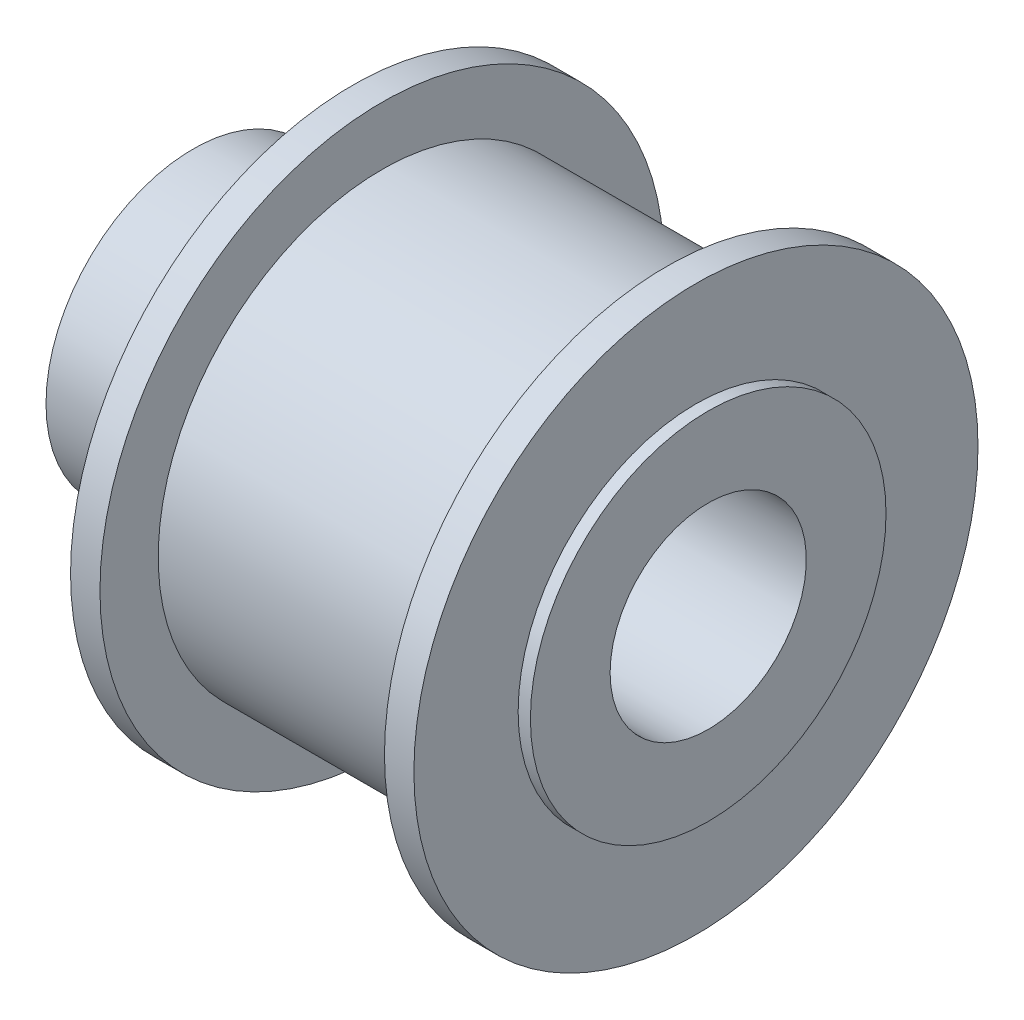
from build123d import *

# Parameters (mm, degrees)
CROQUIS1_R                    = 6
SALIENTE_EXTRUIR1_DEPTH       = 6
CROQUIS2_R                    = 7.25
SALIENTE_EXTRUIR2_DEPTH       = 0.5
CROQUIS3_R                    = 11.5
SALIENTE_EXTRUIR3_DEPTH       = 1.2
CROQUIS4_R                    = 9.125
SALIENTE_EXTRUIR4_DEPTH       = 11.6
CROQUIS5_R                    = 11.5
SALIENTE_EXTRUIR5_DEPTH       = 1.2
CROQUIS6_R                    = 7.25
SALIENTE_EXTRUIR6_DEPTH       = 0.5
CROQUIS7_R                    = 4
CORTAR_EXTRUIR1_DEPTH         = 27.561249971
TALADRO_ROSCADO_M32_D         = 2.5
TALADRO_ROSCADO_M32_DEPTH     = 8.5
TALADRO_ROSCADO_M32_TIP       = 0.751075774
TALADRO_ROSCADO_M33_OUTLINE_W = 1.25
TALADRO_ROSCADO_M33_OUTLINE_H = 5.325356109


# Read off the part's stored shape, not the designer's step: Taladro roscado M33
with BuildPart() as part:
    # Croquis1 → Saliente-Extruir1 (new body)
    with BuildSketch(Plane(origin=(0, 0, 0), x_dir=(0, 0, -1), z_dir=(1, 0, 0))):
        Circle(CROQUIS1_R)
    extrude(amount=SALIENTE_EXTRUIR1_DEPTH)

    # Croquis2 → Saliente-Extruir2 (add)
    with BuildSketch(Plane(origin=(6, 0, 0), x_dir=(0, 0, -1), z_dir=(1, 0, 0))):
        Circle(CROQUIS2_R)
    extrude(amount=SALIENTE_EXTRUIR2_DEPTH)

    # Croquis3 → Saliente-Extruir3 (add)
    with BuildSketch(Plane(origin=(6.5, 0, 0), x_dir=(0, 0, -1), z_dir=(1, 0, 0))):
        Circle(CROQUIS3_R)
    extrude(amount=SALIENTE_EXTRUIR3_DEPTH)

    # Croquis4 → Saliente-Extruir4 (add)
    with BuildSketch(Plane(origin=(7.7, 0, 0), x_dir=(0, 0, -1), z_dir=(1, 0, 0))):
        Circle(CROQUIS4_R)
    extrude(amount=SALIENTE_EXTRUIR4_DEPTH)

    # Croquis5 → Saliente-Extruir5 (add)
    with BuildSketch(Plane(origin=(19.3, 0, 0), x_dir=(0, 0, -1), z_dir=(1, 0, 0))):
        Circle(CROQUIS5_R)
    extrude(amount=SALIENTE_EXTRUIR5_DEPTH)

    # Croquis6 → Saliente-Extruir6 (add)
    with BuildSketch(Plane(origin=(20.5, 0, 0), x_dir=(0, 0, -1), z_dir=(1, 0, 0))):
        Circle(CROQUIS6_R)
    extrude(amount=SALIENTE_EXTRUIR6_DEPTH)

    # Croquis7 → Cortar-Extruir1 (cut, through all)
    with BuildSketch(Plane.ZY):
        Circle(CROQUIS7_R)
    extrude(amount=-CORTAR_EXTRUIR1_DEPTH, mode=Mode.SUBTRACT)

    # Taladro roscado M32
    with Locations(Plane(origin=(0, 0, -6), x_dir=(-1, 0, 0), z_dir=(0, 0, -1))):
        with Locations((-3.5, 0)):
            Hole(TALADRO_ROSCADO_M32_D / 2, depth=TALADRO_ROSCADO_M32_DEPTH)
            with Locations((0, 0, -(TALADRO_ROSCADO_M32_DEPTH + TALADRO_ROSCADO_M32_TIP / 2))):  # 118° drill point
                Cone(0, TALADRO_ROSCADO_M32_D / 2, TALADRO_ROSCADO_M32_TIP, mode=Mode.SUBTRACT)

    # Taladro roscado M33 outline → Taladro roscado M33 (revolve, cut)
    with BuildSketch(Plane(origin=(13.5, 0, 0), x_dir=(1, 0, 0), z_dir=(0, -1, 0))):
        with Locations((0.625, -6.462322169)):
            Rectangle(TALADRO_ROSCADO_M33_OUTLINE_W, TALADRO_ROSCADO_M33_OUTLINE_H)
    revolve(axis=Axis((13.5, 0, 0), (0, 0, 1)), mode=Mode.SUBTRACT)


solid = part.part
